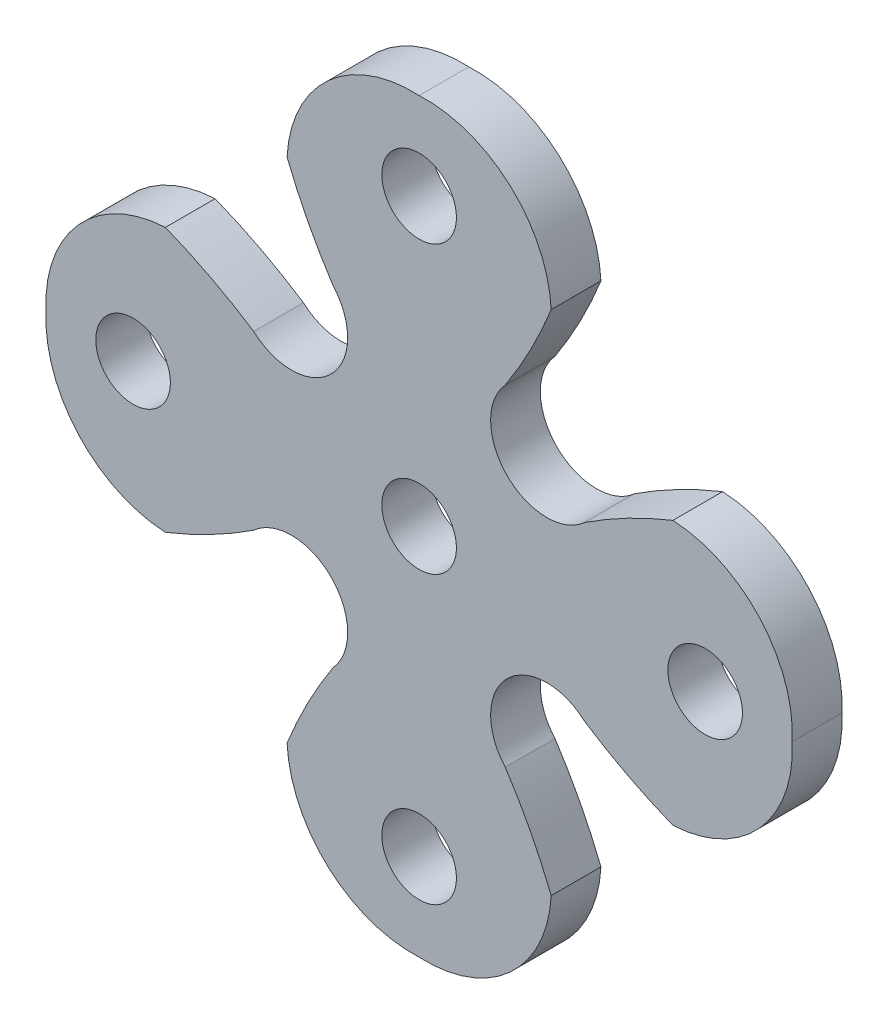
from build123d import *

# Parameters (mm, degrees)
SKETCH1_R           = 1.905
BOSS_EXTRUDE1_DEPTH = 2.54


with BuildPart() as part:
    # Sketch1 → Boss-Extrude1 (new body)
    with BuildSketch(Plane.XY):
        with BuildLine():
            ThreePointArc((-6.74251391, 12.955482668), (-4.633472823, 17.399161687), (0, 19.05))
            ThreePointArc((0, 19.05), (4.633472823, 17.399161687), (6.74251391, 12.955482668))
            ThreePointArc((6.74251391, 12.955482668), (5.682842224, 10.643577378), (4.397291681, 8.449227827))
            ThreePointArc((4.397291681, 8.449227827), (4.490128061, 4.490128061), (8.449227827, 4.397291681))
            ThreePointArc((8.449227827, 4.397291681), (10.643577378, 5.682842224), (12.955482668, 6.74251391))
            ThreePointArc((12.955482668, 6.74251391), (17.399161687, 4.633472823), (19.05, 0))
            ThreePointArc((19.05, 0), (17.399161687, -4.633472823), (12.955482668, -6.74251391))
            ThreePointArc((12.955482668, -6.74251391), (10.643577378, -5.682842224), (8.449227827, -4.397291681))
            ThreePointArc((8.449227827, -4.397291681), (4.490128061, -4.490128061), (4.397291681, -8.449227827))
            ThreePointArc((4.397291681, -8.449227827), (5.682842224, -10.643577378), (6.74251391, -12.955482668))
            ThreePointArc((6.74251391, -12.955482668), (4.633472823, -17.399161687), (0, -19.05))
            ThreePointArc((0, -19.05), (-4.633472823, -17.399161687), (-6.74251391, -12.955482668))
            ThreePointArc((-6.74251391, -12.955482668), (-5.682842224, -10.643577378), (-4.397291681, -8.449227827))
            ThreePointArc((-4.397291681, -8.449227827), (-4.490128061, -4.490128061), (-8.449227827, -4.397291681))
            ThreePointArc((-8.449227827, -4.397291681), (-10.643577378, -5.682842224), (-12.955482668, -6.74251391))
            ThreePointArc((-12.955482668, -6.74251391), (-17.399161687, -4.633472823), (-19.05, 0))
            ThreePointArc((-19.05, 0), (-17.399161687, 4.633472823), (-12.955482668, 6.74251391))
            ThreePointArc((-12.955482668, 6.74251391), (-10.643577378, 5.682842224), (-8.449227827, 4.397291681))
            ThreePointArc((-8.449227827, 4.397291681), (-4.490128061, 4.490128061), (-4.397291681, 8.449227827))
            ThreePointArc((-4.397291681, 8.449227827), (-5.682842224, 10.643577378), (-6.74251391, 12.955482668))
        make_face()
        with Locations((0, 14.605)):
            Circle(SKETCH1_R, mode=Mode.SUBTRACT)
        with Locations((14.605, 0)):
            Circle(SKETCH1_R, mode=Mode.SUBTRACT)
        with Locations((0, -14.605)):
            Circle(SKETCH1_R, mode=Mode.SUBTRACT)
        with Locations((-14.605, 0)):
            Circle(SKETCH1_R, mode=Mode.SUBTRACT)
        Circle(SKETCH1_R, mode=Mode.SUBTRACT)
    extrude(amount=BOSS_EXTRUDE1_DEPTH)


solid = part.part
